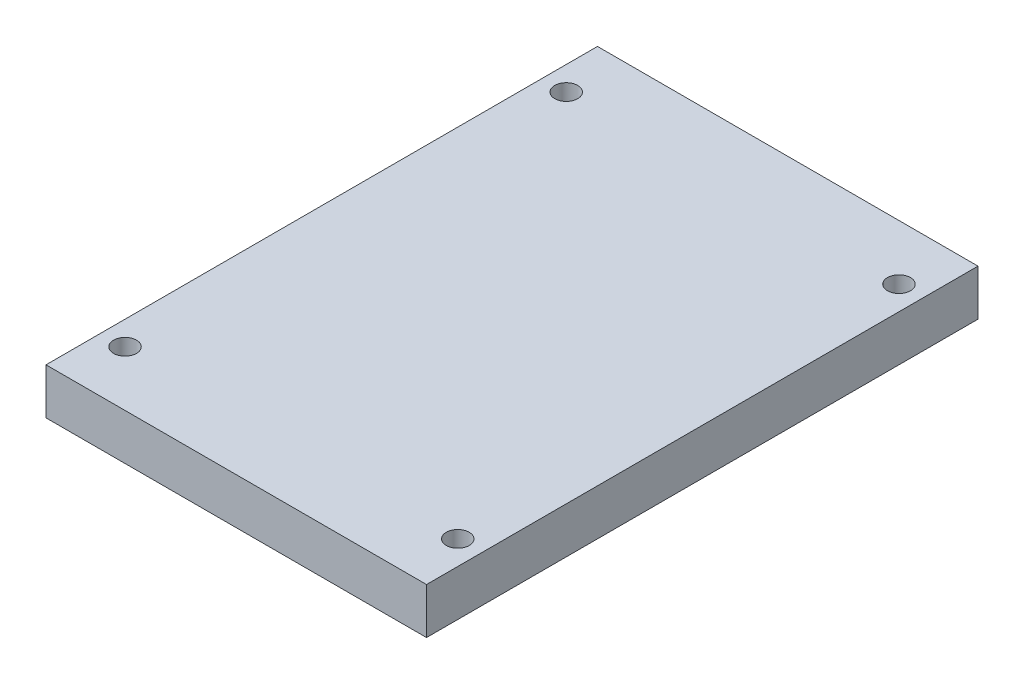
from build123d import *

# Parameters (mm, degrees)
SKETCH1_W           = 53.594
SKETCH1_H           = 76.2
BOSS_EXTRUDE1_DEPTH = 6.35
SKETCH2_R           = 1.5875
CUT_EXTRUDE1_DEPTH  = 94.376010495
SKETCH3_W           = 0.508
SKETCH3_H           = 76.2
CUT_EXTRUDE2_DEPTH  = 94.376010495


with BuildPart() as part:
    # Sketch1 → Boss-Extrude1 (new body)
    with BuildSketch(Plane(origin=(0, 0, 0), x_dir=(1, 0, 0), z_dir=(0, 1, 0))):
        with Locations((-26.797, 38.1)):
            Rectangle(SKETCH1_W, SKETCH1_H)
    extrude(amount=BOSS_EXTRUDE1_DEPTH)

    # Sketch2 → Cut-Extrude1 (cut, through all)
    with BuildSketch(Plane(origin=(0, 6.35, 0), x_dir=(1, 0, 0), z_dir=(0, 1, 0))):
        with Locations((-3.81, 7.62)):
            Circle(SKETCH2_R)
        with Locations((-3.81, 68.58)):
            Circle(SKETCH2_R)
    cut_extrude1 = extrude(amount=-CUT_EXTRUDE1_DEPTH, mode=Mode.SUBTRACT)

    # Mirror1: Cut-Extrude1 across plane
    add(cut_extrude1.mirror(Plane(origin=(-26.797, 0, 0), x_dir=(0, 0, 1), z_dir=(1, 0, 0))), mode=Mode.SUBTRACT)

    # Sketch3 → Cut-Extrude2 (cut, through all)
    with BuildSketch(Plane(origin=(0, 6.35, 0), x_dir=(1, 0, 0), z_dir=(0, 1, 0))):
        with Locations((-0.254, 38.1)):
            Rectangle(SKETCH3_W, SKETCH3_H)
    cut_extrude2 = extrude(amount=-CUT_EXTRUDE2_DEPTH, mode=Mode.SUBTRACT)

    # Mirror2: Cut-Extrude2 across plane
    add(cut_extrude2.mirror(Plane(origin=(-26.797, 0, 0), x_dir=(0, 0, 1), z_dir=(1, 0, 0))), mode=Mode.SUBTRACT)


solid = part.part
